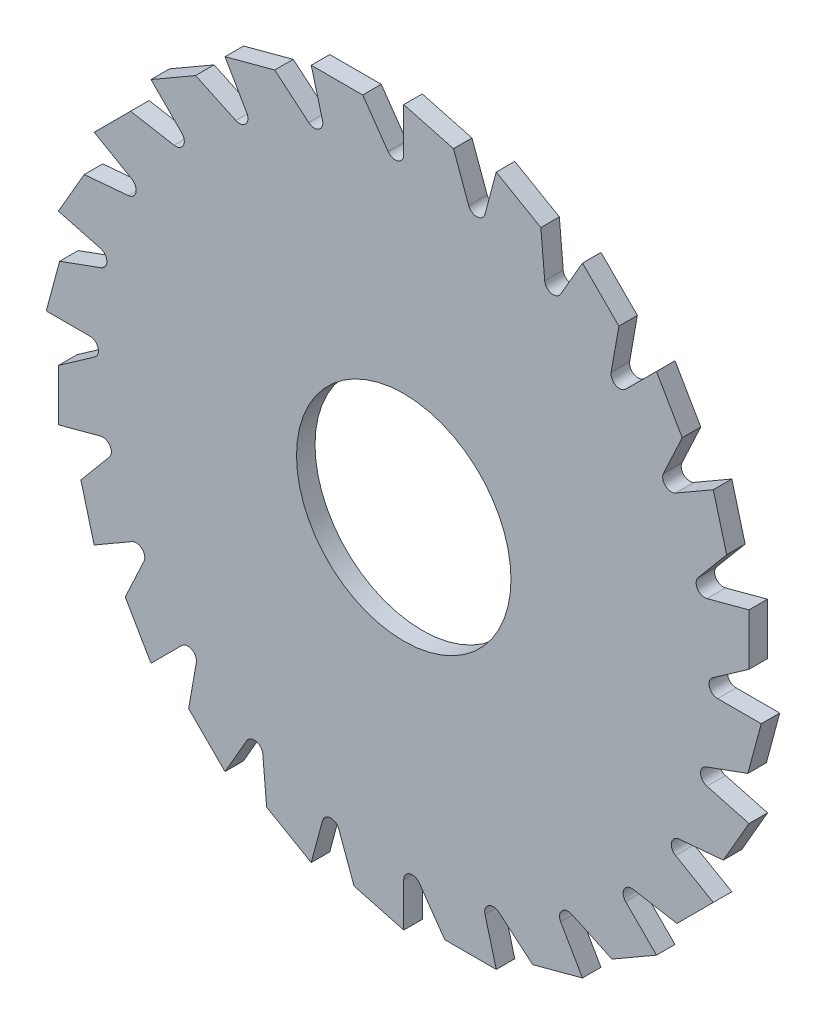
from build123d import *

# Parameters (mm, degrees)
SKETCH1_R           = 9.525
BOSS_EXTRUDE1_DEPTH = 1.644444444


with BuildPart() as part:
    # Sketch1 → Boss-Extrude1 (new body)
    with BuildSketch(Plane.XY):
        with BuildLine():
            Line((4.416212878, 30.566679326), (0, 31.75))
            Line((0, 31.75), (0, 27.878579979))
            ThreePointArc((0, 27.878579979), (-0.532862181, 27.151847662), (-1.386193858, 27.441514734))
            Line((-1.386193858, 27.441514734), (-3.645504682, 30.668144985))
            Line((-3.645504682, 30.668144985), (-8.217504682, 30.668144985))
            Line((-8.217504682, 30.668144985), (-7.215507449, 26.928640402))
            ThreePointArc((-7.215507449, 26.928640402), (-7.542120627, 26.088756008), (-8.441347087, 26.147694424))
            Line((-8.441347087, 26.147694424), (-11.458787122, 28.679627244))
            Line((-11.458787122, 28.679627244), (-15.875, 27.49630657))
            Line((-15.875, 27.49630657), (-13.939289989, 24.143558483))
            ThreePointArc((-13.939289989, 24.143558483), (-14.037396016, 23.247758745), (-14.921236463, 23.071951949))
            Line((-14.921236463, 23.071951949), (-18.491172157, 24.736640303))
            Line((-18.491172157, 24.736640303), (-22.450640303, 22.450640303))
            Line((-22.450640303, 22.450640303), (-19.713132953, 19.713132953))
            ThreePointArc((-19.713132953, 19.713132953), (-19.576046065, 18.822465142), (-20.384268232, 18.423894078))
            Line((-20.384268232, 18.423894078), (-24.263414367, 19.107892204))
            Line((-24.263414367, 19.107892204), (-27.49630657, 15.875))
            Line((-27.49630657, 15.875), (-24.143558483, 13.939289989))
            ThreePointArc((-24.143558483, 13.939289989), (-23.780620926, 13.114451646), (-24.458145807, 12.520278272))
            Line((-24.458145807, 12.520278272), (-28.382144985, 12.176972828))
            Line((-28.382144985, 12.176972828), (-30.668144985, 8.217504682))
            Line((-30.668144985, 8.217504682), (-26.928640402, 7.215507449))
            ThreePointArc((-26.928640402, 7.215507449), (-26.364585769, 6.512709942), (-26.865241165, 5.763426192))
            Line((-26.865241165, 5.763426192), (-30.566679326, 4.416212878))
            Line((-30.566679326, 4.416212878), (-31.75, 0))
            Line((-31.75, 0), (-27.878579979, 0))
            ThreePointArc((-27.878579979, 0), (-27.151847662, -0.532862181), (-27.441514734, -1.386193858))
            Line((-27.441514734, -1.386193858), (-30.668144985, -3.645504682))
            Line((-30.668144985, -3.645504682), (-30.668144985, -8.217504682))
            Line((-30.668144985, -8.217504682), (-26.928640402, -7.215507449))
            ThreePointArc((-26.928640402, -7.215507449), (-26.088756008, -7.542120627), (-26.147694424, -8.441347087))
            Line((-26.147694424, -8.441347087), (-28.679627244, -11.458787122))
            Line((-28.679627244, -11.458787122), (-27.49630657, -15.875))
            Line((-27.49630657, -15.875), (-24.143558483, -13.939289989))
            ThreePointArc((-24.143558483, -13.939289989), (-23.247758745, -14.037396016), (-23.071951949, -14.921236463))
            Line((-23.071951949, -14.921236463), (-24.736640303, -18.491172157))
            Line((-24.736640303, -18.491172157), (-22.450640303, -22.450640303))
            Line((-22.450640303, -22.450640303), (-19.713132953, -19.713132953))
            ThreePointArc((-19.713132953, -19.713132953), (-18.822465142, -19.576046065), (-18.423894078, -20.384268232))
            Line((-18.423894078, -20.384268232), (-19.107892204, -24.263414367))
            Line((-19.107892204, -24.263414367), (-15.875, -27.49630657))
            Line((-15.875, -27.49630657), (-13.939289989, -24.143558483))
            ThreePointArc((-13.939289989, -24.143558483), (-13.114451646, -23.780620926), (-12.520278272, -24.458145807))
            Line((-12.520278272, -24.458145807), (-12.176972828, -28.382144985))
            Line((-12.176972828, -28.382144985), (-8.217504682, -30.668144985))
            Line((-8.217504682, -30.668144985), (-7.215507449, -26.928640402))
            ThreePointArc((-7.215507449, -26.928640402), (-6.512709942, -26.364585769), (-5.763426192, -26.865241165))
            Line((-5.763426192, -26.865241165), (-4.416212878, -30.566679326))
            Line((-4.416212878, -30.566679326), (0, -31.75))
            Line((0, -31.75), (0, -27.878579979))
            ThreePointArc((0, -27.878579979), (0.532862181, -27.151847662), (1.386193858, -27.441514734))
            Line((1.386193858, -27.441514734), (3.645504682, -30.668144985))
            Line((3.645504682, -30.668144985), (8.217504682, -30.668144985))
            Line((8.217504682, -30.668144985), (7.215507449, -26.928640402))
            ThreePointArc((7.215507449, -26.928640402), (7.542120627, -26.088756008), (8.441347087, -26.147694424))
            Line((8.441347087, -26.147694424), (11.458787122, -28.679627244))
            Line((11.458787122, -28.679627244), (15.875, -27.49630657))
            Line((15.875, -27.49630657), (13.939289989, -24.143558483))
            ThreePointArc((13.939289989, -24.143558483), (14.037396016, -23.247758745), (14.921236463, -23.071951949))
            Line((14.921236463, -23.071951949), (18.491172157, -24.736640303))
            Line((18.491172157, -24.736640303), (22.450640303, -22.450640303))
            Line((22.450640303, -22.450640303), (19.713132953, -19.713132953))
            ThreePointArc((19.713132953, -19.713132953), (19.576046065, -18.822465142), (20.384268232, -18.423894078))
            Line((20.384268232, -18.423894078), (24.263414367, -19.107892204))
            Line((24.263414367, -19.107892204), (27.49630657, -15.875))
            Line((27.49630657, -15.875), (24.143558483, -13.939289989))
            ThreePointArc((24.143558483, -13.939289989), (23.780620926, -13.114451646), (24.458145807, -12.520278272))
            Line((24.458145807, -12.520278272), (28.382144985, -12.176972828))
            Line((28.382144985, -12.176972828), (30.668144985, -8.217504682))
            Line((30.668144985, -8.217504682), (26.928640402, -7.215507449))
            ThreePointArc((26.928640402, -7.215507449), (26.364585769, -6.512709942), (26.865241165, -5.763426192))
            Line((26.865241165, -5.763426192), (30.566679326, -4.416212878))
            Line((30.566679326, -4.416212878), (31.75, 0))
            Line((31.75, 0), (27.878579979, 0))
            ThreePointArc((27.878579979, 0), (27.151847662, 0.532862181), (27.441514734, 1.386193858))
            Line((27.441514734, 1.386193858), (30.668144985, 3.645504682))
            Line((30.668144985, 3.645504682), (30.668144985, 8.217504682))
            Line((30.668144985, 8.217504682), (26.928640402, 7.215507449))
            ThreePointArc((26.928640402, 7.215507449), (26.088756008, 7.542120627), (26.147694424, 8.441347087))
            Line((26.147694424, 8.441347087), (28.679627244, 11.458787122))
            Line((28.679627244, 11.458787122), (27.49630657, 15.875))
            Line((27.49630657, 15.875), (24.143558483, 13.939289989))
            ThreePointArc((24.143558483, 13.939289989), (23.247758745, 14.037396016), (23.071951949, 14.921236463))
            Line((23.071951949, 14.921236463), (24.736640303, 18.491172157))
            Line((24.736640303, 18.491172157), (22.450640303, 22.450640303))
            Line((22.450640303, 22.450640303), (19.713132953, 19.713132953))
            ThreePointArc((19.713132953, 19.713132953), (18.822465142, 19.576046065), (18.423894078, 20.384268232))
            Line((18.423894078, 20.384268232), (19.107892204, 24.263414367))
            Line((19.107892204, 24.263414367), (15.875, 27.49630657))
            Line((15.875, 27.49630657), (13.939289989, 24.143558483))
            ThreePointArc((13.939289989, 24.143558483), (13.114451646, 23.780620926), (12.520278272, 24.458145807))
            Line((12.520278272, 24.458145807), (12.176972828, 28.382144985))
            Line((12.176972828, 28.382144985), (8.217504682, 30.668144985))
            Line((8.217504682, 30.668144985), (7.215507449, 26.928640402))
            ThreePointArc((7.215507449, 26.928640402), (6.512709942, 26.364585769), (5.763426192, 26.865241165))
            Line((5.763426192, 26.865241165), (4.416212878, 30.566679326))
        make_face()
        Circle(SKETCH1_R, mode=Mode.SUBTRACT)
    extrude(amount=BOSS_EXTRUDE1_DEPTH)


solid = part.part
